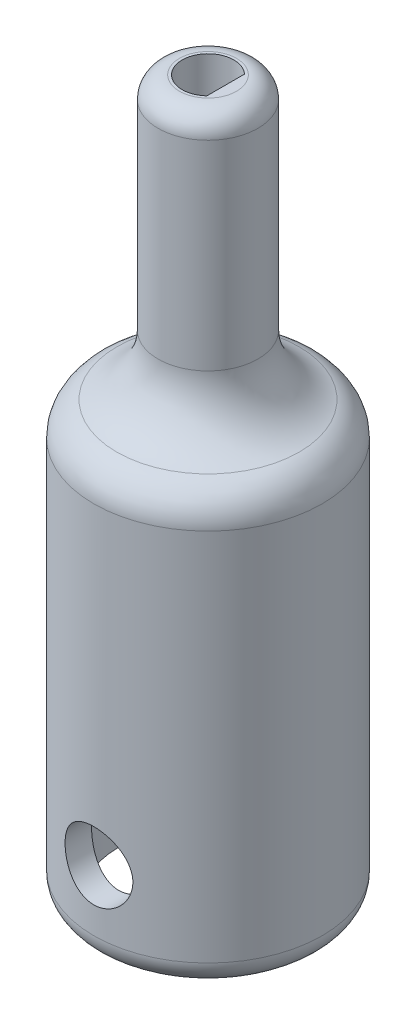
from build123d import *

# Parameters (mm, degrees)
CUT_EXTRUDE1_DEPTH      = 103.528044944
CUT_EXTRUDE1_DEPTH_BACK = 103.528044944
SKETCH2_R               = 4.75
SKETCH3_R               = 12.5
CUT_EXTRUDE2_DEPTH      = 53
CUT_EXTRUDE3_DEPTH      = 43
FILLET1_R               = 5
FILLET2_R               = 3
FILLET3_R               = 3.5


with BuildPart() as part:
    # Sketch1 → Revolve1 (revolve)
    with BuildSketch(Plane(origin=(0, 0, 0), x_dir=(0, 0, -1), z_dir=(1, 0, 0)), mode=Mode.PRIVATE) as revolve1_sk:
        with BuildLine():
            Line((0, 0), (-16, 0))
            Line((-16, 0), (-16, 60))
            ThreePointArc((-16, 60), (-9.636038969, 62.636038969), (-7, 69))
            Line((-7, 69), (-7, 80))
            Line((-7, 80), (-7, 100))
            Line((-7, 100), (0, 100))
            Line((0, 100), (0, 0))
        make_face()
    revolve(revolve1_sk.sketch.rotate(Axis((0, 2.411465541, 0), (0, 1, 0)), 180), axis=Axis((0, 2.411465541, 0), (0, 1, 0)))

    # Sketch2 → Cut-Extrude1 (cut, two sides: drawn at the far end of the back side and taken through both)
    with BuildSketch(Plane.XY.offset(-CUT_EXTRUDE1_DEPTH_BACK)):
        with Locations((0, 12)):
            Circle(SKETCH2_R)
    extrude(amount=CUT_EXTRUDE1_DEPTH + CUT_EXTRUDE1_DEPTH_BACK, mode=Mode.SUBTRACT)

    # Sketch3 → Cut-Extrude2 (cut)
    with BuildSketch(Plane.XZ):
        with Locations(Location((0, 0, 0), (0, 0, 270))):
            Circle(SKETCH3_R)
    extrude(amount=-CUT_EXTRUDE2_DEPTH, mode=Mode.SUBTRACT)

    # Sketch4 → Cut-Extrude3 (cut)
    with BuildSketch(Plane(origin=(0, 100, 0), x_dir=(1, 0, 0), z_dir=(0, 1, 0))):
        with BuildLine():
            Line((2.4765, -2.639645431), (2.4765, 2.639645431))
            ThreePointArc((2.4765, 2.639645431), (-3.6195, 0), (2.4765, -2.639645431))
        make_face()
    extrude(amount=-CUT_EXTRUDE3_DEPTH, mode=Mode.SUBTRACT)

    # Fillet1
    fillet1_edges = [part.edges().sort_by_distance(p)[0] for p in [
        (0, 60, 16),
    ]]
    fillet(fillet1_edges, radius=FILLET1_R)

    # Fillet2
    fillet2_edges = [part.edges().sort_by_distance(p)[0] for p in [
        (0, 100, 7),
    ]]
    fillet(fillet2_edges, radius=FILLET2_R)

    # Fillet3
    fillet3_edges = [part.edges().sort_by_distance(p)[0] for p in [
        (0, 0, 16),
    ]]
    fillet(fillet3_edges, radius=FILLET3_R - 0.0001)  # a hair under: the kernel refuses the full size


solid = part.part
